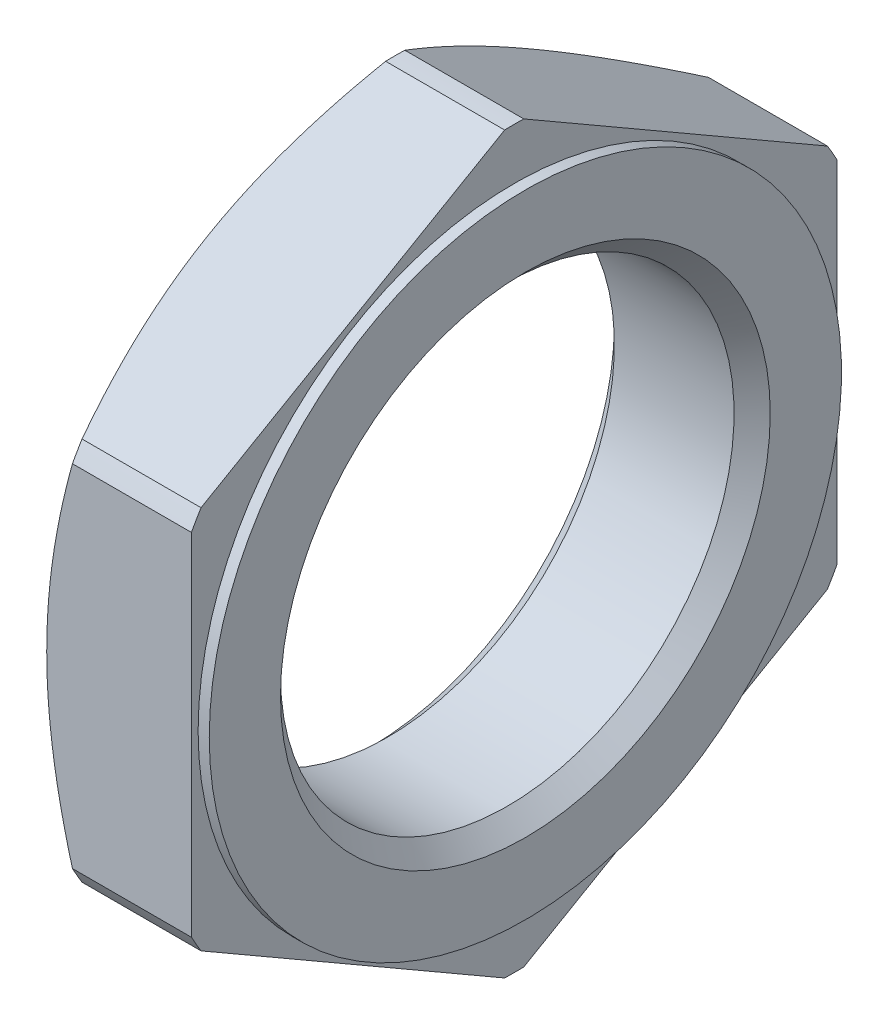
from build123d import *

# Parameters (mm, degrees)
SKETCH_3_W          = 58
SKETCH_3_H          = 58
CUT_EXTRUDE_1_DEPTH = 7


with BuildPart() as part:
    # 草图1 → 旋转1 (revolve)
    with BuildSketch(Plane.XY):
        Polygon((0, 0), (0, 14.5), (1.154700538, 16.5), (6.5, 16.5), (6.5, 14.2), (7, 14.2), (7, 0), align=None)
    revolve(axis=Axis((7, 0, 0), (-1, 0, 0)))

    # 草图2 → 切除-旋转1 (revolve, cut)
    with BuildSketch(Plane.XY):
        Polygon((0, 0), (0, 11), (0.812, 10.188), (6.188, 10.188), (7, 11), (7, 0), align=None)
    revolve(axis=Axis((7, 0, 0), (-1, 0, 0)), mode=Mode.SUBTRACT)

    # 草图3 → 切除-拉伸1 (cut)
    with BuildSketch(Plane(origin=(0, 0, 0), x_dir=(0, 0, -1), z_dir=(1, 0, 0))):
        Rectangle(SKETCH_3_W, SKETCH_3_H)
        Polygon((-14.5, -8.371578903), (0, -16.743157806), (14.5, -8.371578903), (14.5, 8.371578903), (0, 16.743157806), (-14.5, 8.371578903), align=None, mode=Mode.SUBTRACT)
    extrude(amount=CUT_EXTRUDE_1_DEPTH, mode=Mode.SUBTRACT)


solid = part.part
